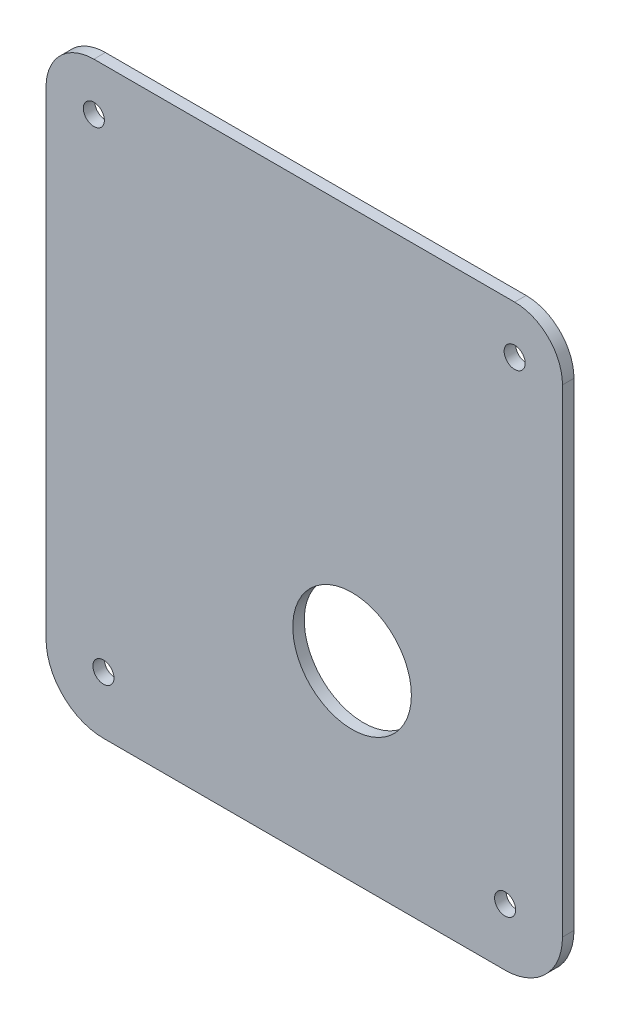
from build123d import *

# Parameters (mm, degrees)
BASE_FLANGE1_DEPTH   = 3
SKETCH2_R            = 15.5
CUT_EXTRUDE1_DEPTH   = 131.05864062
M5_CLEARANCE_HOLE1_D = 5.5


# Sheet-metal steps are written as plain solids
with BuildPart() as part:
    # Sketch1 → Base-Flange1 (new body)
    with BuildSketch(Plane.XY):
        with BuildLine():
            Line((-67.5, 102.5), (42.5, 102.5))
            ThreePointArc((42.5, 102.5), (51.338834765, 98.838834765), (55, 90))
            Line((55, 90), (55, -35))
            ThreePointArc((55, -35), (50.606601718, -45.606601718), (40, -50))
            Line((40, -50), (-65, -50))
            ThreePointArc((-65, -50), (-75.606601718, -45.606601718), (-80, -35))
            Line((-80, -35), (-80, 90))
            ThreePointArc((-80, 90), (-76.338834765, 98.838834765), (-67.5, 102.5))
        make_face()
    extrude(amount=BASE_FLANGE1_DEPTH)

    # Sketch2 → Cut-Extrude1 (cut, through all)
    with BuildSketch(Plane.XY.offset(3)):
        Circle(SKETCH2_R)
    extrude(amount=-CUT_EXTRUDE1_DEPTH, mode=Mode.SUBTRACT)

    # M5 Clearance Hole1 (through all)
    with Locations(Plane(origin=(0, 0, 0), x_dir=(-1, 0, 0), z_dir=(0, 0, -1))):
        with Locations((-40, -35), (67.5, 90), (65, -35), (-42.5, 90)):
            Hole(M5_CLEARANCE_HOLE1_D / 2)


solid = part.part
